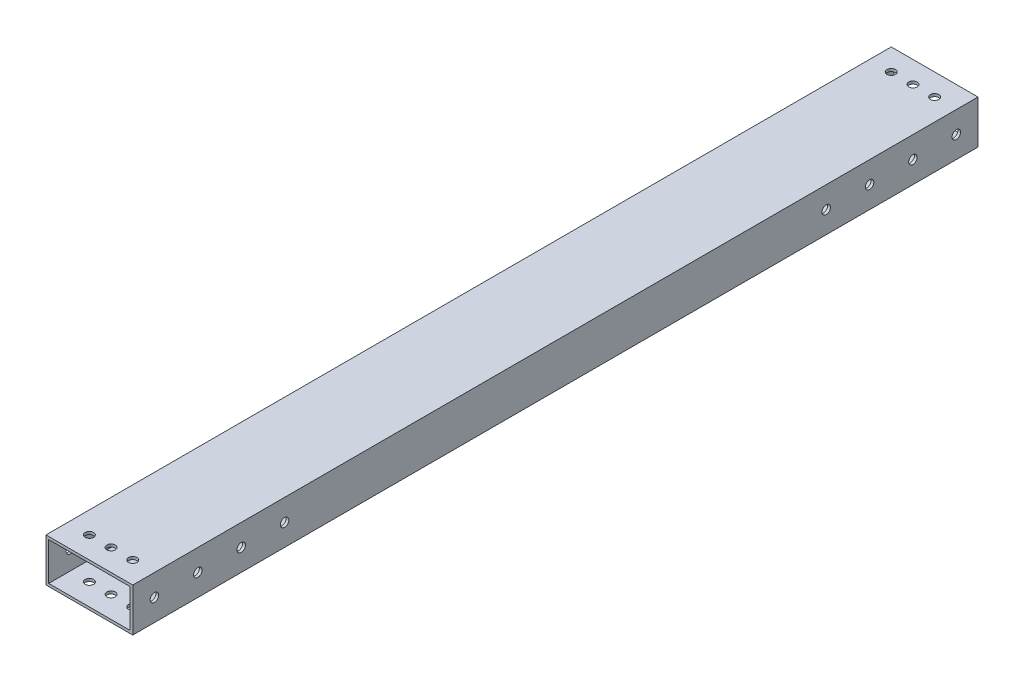
from build123d import *

# Parameters (mm, degrees)
SKETCH1_W           = 50.8
SKETCH1_H           = 25.4
SKETCH1_W_2         = 47.625
SKETCH1_H_2         = 22.225
BOSS_EXTRUDE1_DEPTH = 247.4595
SKETCH2_R           = 2.4892
CUT_EXTRUDE1_DEPTH  = 251.053042653
SKETCH3_R           = 2.4892
CUT_EXTRUDE2_DEPTH  = 253.938992922


with BuildPart() as part:
    # Sketch1 → Boss-Extrude1 (new, symmetric)
    with BuildSketch(Plane.XY):
        Rectangle(SKETCH1_W, SKETCH1_H)
        Rectangle(SKETCH1_W_2, SKETCH1_H_2, mode=Mode.SUBTRACT)
    extrude(amount=BOSS_EXTRUDE1_DEPTH, both=True)

    # Sketch2 → Cut-Extrude1 (cut, through all)
    with BuildSketch(Plane(origin=(0, 12.7, 0), x_dir=(1, 0, 0), z_dir=(0, 1, 0))):
        with Locations((-12.7, 234.7595)):
            Circle(SKETCH2_R)
        with Locations((0, 234.7595)):
            Circle(SKETCH2_R)
        with Locations((12.7, 234.7595)):
            Circle(SKETCH2_R)
        with Locations((12.7, -234.7595)):
            Circle(SKETCH2_R)
        with Locations((0, -234.7595)):
            Circle(SKETCH2_R)
        with Locations((-12.7, -234.7595)):
            Circle(SKETCH2_R)
    extrude(amount=-CUT_EXTRUDE1_DEPTH, mode=Mode.SUBTRACT)

    # Sketch3 → Cut-Extrude2 (cut, through all)
    with BuildSketch(Plane(origin=(25.4, 0, 0), x_dir=(0, 0, -1), z_dir=(1, 0, 0))):
        with Locations((234.7595, 0)):
            Circle(SKETCH3_R)
        with Locations((-234.7595, 0)):
            Circle(SKETCH3_R)
        with Locations((209.3595, 0)):
            Circle(SKETCH3_R)
        with Locations((183.9595, 0)):
            Circle(SKETCH3_R)
        with Locations((158.5595, 0)):
            Circle(SKETCH3_R)
        with Locations((-158.5595, 0)):
            Circle(SKETCH3_R)
        with Locations((-183.9595, 0)):
            Circle(SKETCH3_R)
        with Locations((-209.3595, 0)):
            Circle(SKETCH3_R)
    extrude(amount=-CUT_EXTRUDE2_DEPTH, mode=Mode.SUBTRACT)


solid = part.part
